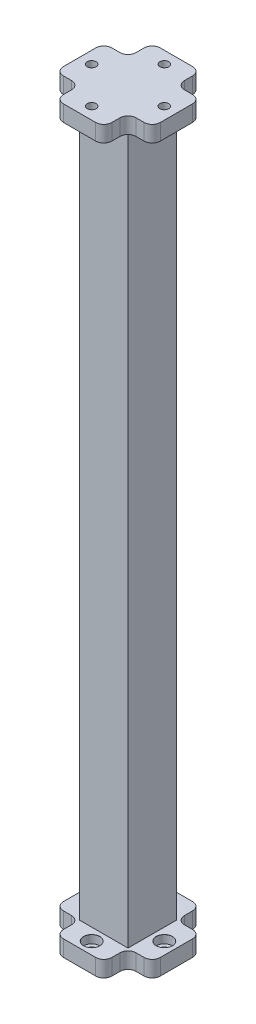
from build123d import *

# Parameters (mm, degrees)
SKETCH1_W                     = 30
SKETCH1_H                     = 30
BOSS_EXTRUDE1_DEPTH           = 458
SKETCH2_W                     = 15
SKETCH2_H                     = 30
SKETCH2_W_2                   = 30
SKETCH2_H_2                   = 15
BOSS_EXTRUDE2_DEPTH           = 10
CBORE_FOR_M5_SHCS1_AT_2_COUNT = 2
CBORE_FOR_M5_SHCS1_AT_2_PITCH = 45
CBORE_FOR_M5_SHCS1_AT_3_COUNT = 2
CBORE_FOR_M5_SHCS1_AT_3_PITCH = 31.819805153
CBORE_FOR_M5_SHCS1_AT_4_COUNT = 2
CBORE_FOR_M5_SHCS1_AT_4_PITCH = 31.819805153
FILLET1_R                     = 5
FILLET1_OF_MIRROR1_R          = 5


with BuildPart() as part:
    # Sketch1 → Boss-Extrude1 (new body)
    with BuildSketch(Plane(origin=(0, 0, 0), x_dir=(1, 0, 0), z_dir=(0, 1, 0))):
        Rectangle(SKETCH1_W, SKETCH1_H)
    extrude(amount=BOSS_EXTRUDE1_DEPTH)

    # Sketch2 → Boss-Extrude2 (add)
    with BuildSketch(Plane(origin=(0, 0, 0), x_dir=(1, 0, 0), z_dir=(0, 1, 0))):
        with Locations((22.5, 0)):
            Rectangle(SKETCH2_W, SKETCH2_H)
        with Locations((0, -22.5)):
            Rectangle(SKETCH2_W_2, SKETCH2_H_2)
        with Locations((0, 22.5)):
            Rectangle(SKETCH2_W_2, SKETCH2_H_2)
        with Locations((-22.5, 0)):
            Rectangle(SKETCH2_W, SKETCH2_H)
    boss_extrude2 = extrude(amount=BOSS_EXTRUDE2_DEPTH)

    # Sketch4 → CBORE for M5 SHCS1 (revolve, cut)
    with BuildSketch(Plane(origin=(-22.5, 10, 0), x_dir=(0, 0, 1), z_dir=(1, 0, 0))):
        Polygon((0, 0), (0, 10), (2.75, 10), (2.75, 5), (5, 5), (5, 0.025), (5.025, 0), align=None)
    cbore_for_m5_shcs1 = revolve(axis=Axis((-22.5, 16.35, 0), (0, -1, 0)), mode=Mode.SUBTRACT)

    # CBORE for M5 SHCS1 at 2: CBORE for M5 SHCS1 ×2
    with Locations(*[(i * CBORE_FOR_M5_SHCS1_AT_2_PITCH, 0, 0) for i in range(1, CBORE_FOR_M5_SHCS1_AT_2_COUNT)]):
        add(cbore_for_m5_shcs1, mode=Mode.SUBTRACT)

    # CBORE for M5 SHCS1 at 3: CBORE for M5 SHCS1 ×2
    with Locations(*[Vector(0.7071067811865476, 0, -0.7071067811865476) * (i * CBORE_FOR_M5_SHCS1_AT_3_PITCH) for i in range(1, CBORE_FOR_M5_SHCS1_AT_3_COUNT)]):
        add(cbore_for_m5_shcs1, mode=Mode.SUBTRACT)

    # CBORE for M5 SHCS1 at 4: CBORE for M5 SHCS1 ×2
    with Locations(*[Vector(0.7071067811865476, 0, 0.7071067811865476) * (i * CBORE_FOR_M5_SHCS1_AT_4_PITCH) for i in range(1, CBORE_FOR_M5_SHCS1_AT_4_COUNT)]):
        add(cbore_for_m5_shcs1, mode=Mode.SUBTRACT)

    # Fillet1
    # the kernel refuses this fillet: 5 mm, written as the material it adds along each edge
    with BuildSketch(Plane(origin=(15, 0, 15), x_dir=(0, 0, 1), z_dir=(0, 1, 0)), Plane(origin=(15, 0, -15), x_dir=(1, 0, 0), z_dir=(0, 1, 0))) as fillet1_piece_1:
        with BuildLine():
            CenterArc((FILLET1_R, FILLET1_R), FILLET1_R, 180, 90)
            Line((0, FILLET1_R), (0, 0))
            Line((0, 0), (FILLET1_R, 0))
        make_face()
    extrude(amount=10)
    with BuildSketch(Plane(origin=(-15, 0, 15), x_dir=(0, 0, 1), z_dir=(0, 1, 0)), Plane(origin=(-15, 0, -15), x_dir=(-1, 0, 0), z_dir=(0, 1, 0))) as fillet1_piece_2:
        with BuildLine():
            CenterArc((FILLET1_R, -FILLET1_R), FILLET1_R, 90, 90)
            Line((0, -FILLET1_R), (0, 0))
            Line((0, 0), (FILLET1_R, 0))
        make_face()
    extrude(amount=10)
    # the kernel refuses this fillet: 5 mm, written as the material it takes off along each edge
    with BuildSketch(Plane(origin=(30, -12.5, 15), x_dir=(-1, 0, 0), z_dir=(0, 1, 0)), Plane(origin=(30, -12.5, -15), x_dir=(0, 0, 1), z_dir=(0, 1, 0)), Plane(origin=(-15, -12.5, 30), x_dir=(0, 0, -1), z_dir=(0, 1, 0)), Plane(origin=(15, -12.5, 30), x_dir=(-1, 0, 0), z_dir=(0, 1, 0)), Plane(origin=(-30, -12.5, -15), x_dir=(1, 0, 0), z_dir=(0, 1, 0))) as fillet1_2_piece_1:
        with BuildLine():
            CenterArc((FILLET1_R, -FILLET1_R), FILLET1_R, 90, 90)
            Line((0, -FILLET1_R), (0, 0))
            Line((0, 0), (FILLET1_R, 0))
        make_face()
    extrude(amount=35, mode=Mode.SUBTRACT)
    with BuildSketch(Plane(origin=(15, -12.5, -30), x_dir=(-1, 0, 0), z_dir=(0, 1, 0)), Plane(origin=(-15, -12.5, -30), x_dir=(0, 0, 1), z_dir=(0, 1, 0)), Plane(origin=(-30, -12.5, 15), x_dir=(1, 0, 0), z_dir=(0, 1, 0))) as fillet1_2_piece_2:
        with BuildLine():
            CenterArc((FILLET1_R, FILLET1_R), FILLET1_R, 180, 90)
            Line((0, FILLET1_R), (0, 0))
            Line((0, 0), (FILLET1_R, 0))
        make_face()
    extrude(amount=35, mode=Mode.SUBTRACT)

    # Mirror1: Boss-Extrude2, CBORE for M5 SHCS1 across plane
    add(boss_extrude2.mirror(Plane.ZX.offset(229)))
    add(cbore_for_m5_shcs1.mirror(Plane.ZX.offset(229)), mode=Mode.SUBTRACT)

    # Mirror1 copy 1 sketch → Mirror1 copy 1 (revolve, cut)
    with BuildSketch(Plane(origin=(22.5, 448, 0), x_dir=(0, 0, 1), z_dir=(1, 0, 0))):
        Polygon((0, 0), (0, -10), (2.75, -10), (2.75, -5), (5, -5), (5, -0.025), (5.025, 0), align=None)
    revolve(axis=Axis((22.5, 441.65, 0), (0, -1, 0)), mode=Mode.SUBTRACT)

    # Mirror1 copy 2 sketch → Mirror1 copy 2 (revolve, cut)
    with BuildSketch(Plane(origin=(0, 448, -22.5), x_dir=(0, 0, 1), z_dir=(1, 0, 0))):
        Polygon((0, 0), (0, -10), (2.75, -10), (2.75, -5), (5, -5), (5, -0.025), (5.025, 0), align=None)
    revolve(axis=Axis((0, 441.65, -22.5), (0, -1, 0)), mode=Mode.SUBTRACT)

    # Mirror1 copy 3 sketch → Mirror1 copy 3 (revolve, cut)
    with BuildSketch(Plane(origin=(0, 448, 22.5), x_dir=(0, 0, 1), z_dir=(1, 0, 0))):
        Polygon((0, 0), (0, -10), (2.75, -10), (2.75, -5), (5, -5), (5, -0.025), (5.025, 0), align=None)
    revolve(axis=Axis((0, 441.65, 22.5), (0, -1, 0)), mode=Mode.SUBTRACT)

    # Fillet1 of Mirror1
    # the kernel refuses this fillet: 5 mm, written as the material it adds along each edge
    with BuildSketch(Plane(origin=(15, 448, 15), x_dir=(0, 0, 1), z_dir=(0, 1, 0)), Plane(origin=(-15, 448, 15), x_dir=(-1, 0, 0), z_dir=(0, 1, 0))) as fillet1_of_mirror1_piece_1:
        with BuildLine():
            CenterArc((FILLET1_OF_MIRROR1_R, FILLET1_OF_MIRROR1_R), FILLET1_OF_MIRROR1_R, 180, 90)
            Line((0, FILLET1_OF_MIRROR1_R), (0, 0))
            Line((0, 0), (FILLET1_OF_MIRROR1_R, 0))
        make_face()
    extrude(amount=10)
    with BuildSketch(Plane(origin=(15, 448, -15), x_dir=(0, 0, -1), z_dir=(0, 1, 0)), Plane(origin=(-15, 448, -15), x_dir=(-1, 0, 0), z_dir=(0, 1, 0))) as fillet1_of_mirror1_piece_2:
        with BuildLine():
            CenterArc((FILLET1_OF_MIRROR1_R, -FILLET1_OF_MIRROR1_R), FILLET1_OF_MIRROR1_R, 90, 90)
            Line((0, -FILLET1_OF_MIRROR1_R), (0, 0))
            Line((0, 0), (FILLET1_OF_MIRROR1_R, 0))
        make_face()
    extrude(amount=10)
    # the kernel refuses this fillet: 5 mm, written as the material it takes off along each edge
    with BuildSketch(Plane(origin=(30, 470.5, 15), x_dir=(-1, 0, 0), z_dir=(0, -1, 0)), Plane(origin=(30, 470.5, -15), x_dir=(0, 0, 1), z_dir=(0, -1, 0)), Plane(origin=(-15, 470.5, 30), x_dir=(0, 0, -1), z_dir=(0, -1, 0)), Plane(origin=(15, 470.5, 30), x_dir=(-1, 0, 0), z_dir=(0, -1, 0)), Plane(origin=(-15, 470.5, -30), x_dir=(1, 0, 0), z_dir=(0, -1, 0)), Plane(origin=(-30, 470.5, -15), x_dir=(1, 0, 0), z_dir=(0, -1, 0))) as fillet1_of_mirror1_2_piece_1:
        with BuildLine():
            CenterArc((FILLET1_OF_MIRROR1_R, FILLET1_OF_MIRROR1_R), FILLET1_OF_MIRROR1_R, 180, 90)
            Line((0, FILLET1_OF_MIRROR1_R), (0, 0))
            Line((0, 0), (FILLET1_OF_MIRROR1_R, 0))
        make_face()
    extrude(amount=35, mode=Mode.SUBTRACT)
    with BuildSketch(Plane(origin=(15, 470.5, -30), x_dir=(-1, 0, 0), z_dir=(0, -1, 0)), Plane(origin=(-30, 470.5, 15), x_dir=(1, 0, 0), z_dir=(0, -1, 0))) as fillet1_of_mirror1_2_piece_2:
        with BuildLine():
            CenterArc((FILLET1_OF_MIRROR1_R, -FILLET1_OF_MIRROR1_R), FILLET1_OF_MIRROR1_R, 90, 90)
            Line((0, -FILLET1_OF_MIRROR1_R), (0, 0))
            Line((0, 0), (FILLET1_OF_MIRROR1_R, 0))
        make_face()
    extrude(amount=35, mode=Mode.SUBTRACT)


solid = part.part
